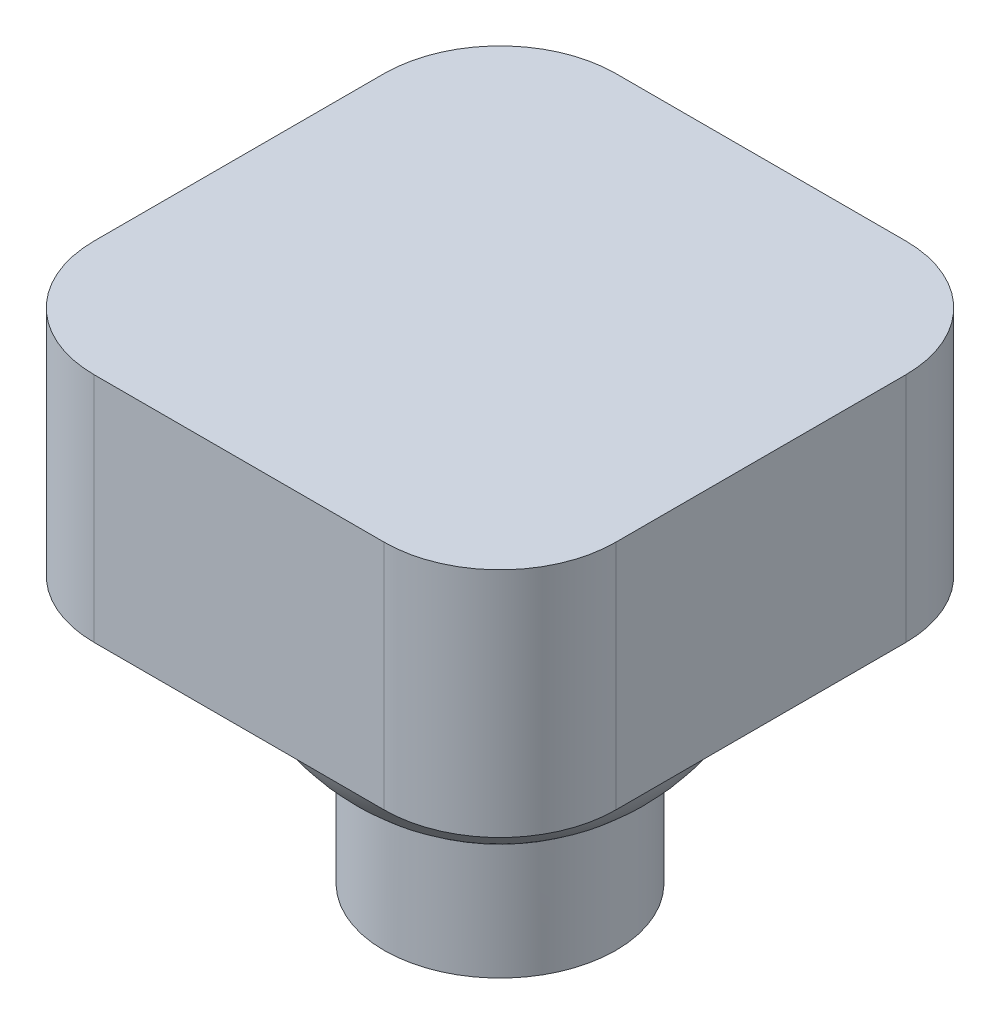
from build123d import *

# Parameters (mm, degrees)
SKETCH1_R           = 25.4
BOSS_EXTRUDE1_DEPTH = 25.4
SKETCH3_W           = 114.3
SKETCH3_H           = 114.3
BOSS_EXTRUDE2_DEPTH = 50.8
FILLET1_R           = 25.4


with BuildPart() as part:
    # Sketch1 → Boss-Extrude1 (new body)
    with BuildSketch(Plane(origin=(0, 0, 0), x_dir=(1, 0, 0), z_dir=(0, 1, 0))):
        Circle(SKETCH1_R)
    extrude(amount=BOSS_EXTRUDE1_DEPTH)

    # Sketch2 → Revolve1 (revolve)
    with BuildSketch(Plane.XY):
        with BuildLine():
            ThreePointArc((44.45, 61.877972806), (31.430896424, 93.308869229), (0, 106.327972806))
            Line((0, 106.327972806), (0, 25.4))
            Line((0, 25.4), (25.4, 25.4))
            ThreePointArc((25.4, 25.4), (39.400713826, 41.301621088), (44.45, 61.877972806))
        make_face()
    revolve(axis=Axis((0, 145.460296173, 0), (0, -1, 0)))

    # Sketch3 → Boss-Extrude2 (add)
    with BuildSketch(Plane(origin=(0, 58.42, 0), x_dir=(1, 0, 0), z_dir=(0, 1, 0))):
        Rectangle(SKETCH3_W, SKETCH3_H)
    extrude(amount=BOSS_EXTRUDE2_DEPTH)

    # Fillet1
    fillet1_edges = [part.edges().sort_by_distance(p)[0] for p in [
        (-57.15, 83.82, -57.15),
        (57.15, 83.82, -57.15),
        (57.15, 83.82, 57.15),
        (-57.15, 83.82, 57.15),
    ]]
    fillet(fillet1_edges, radius=FILLET1_R)


solid = part.part
